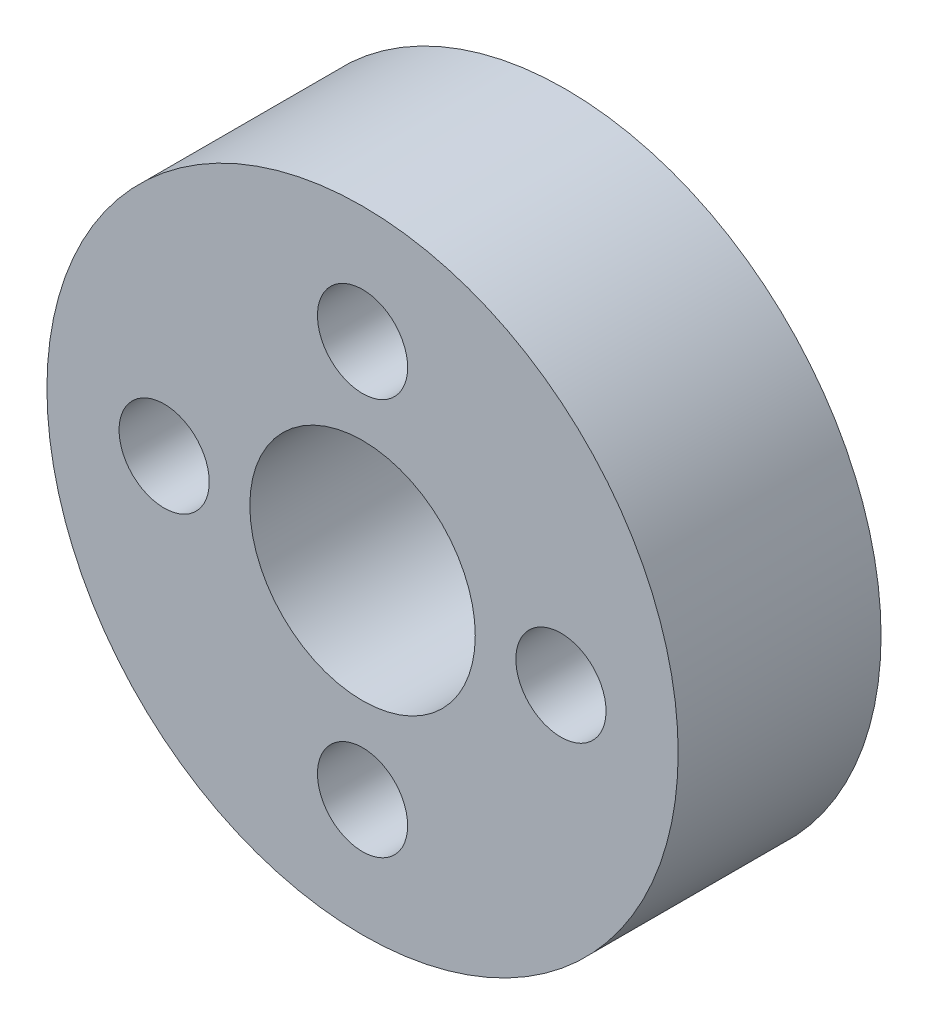
from build123d import *
from build123d.topology import SkipClean

# Parameters (mm, degrees)
SKETCH1_R           = 17.78
SKETCH1_R_2         = 2.54
SKETCH1_R_3         = 6.35
BOSS_EXTRUDE1_DEPTH = 11.43
BOSS_EXTRUDE2_START = 3.175
SKETCH2_W           = 16.51
SKETCH2_H           = 16.51
SKETCH2_R           = 6.35
BOSS_EXTRUDE2_DEPTH = 3.175


with BuildPart() as part:
    # Sketch1 → Boss-Extrude1 (new body)
    with BuildSketch(Plane.XY):
        Circle(SKETCH1_R)
        with Locations((-11.176, 0)):
            Circle(SKETCH1_R_2, mode=Mode.SUBTRACT)
        with Locations((0, -11.176)):
            Circle(SKETCH1_R_2, mode=Mode.SUBTRACT)
        with Locations((11.176, 0)):
            Circle(SKETCH1_R_2, mode=Mode.SUBTRACT)
        with Locations((0, 11.176)):
            Circle(SKETCH1_R_2, mode=Mode.SUBTRACT)
        Circle(SKETCH1_R_3, mode=Mode.SUBTRACT)
    extrude(amount=BOSS_EXTRUDE1_DEPTH)

    # Sketch2 → Boss-Extrude2 (add)
    with SkipClean():  # the faces are left unmerged after this step: merging them gives an invalid solid
        with BuildSketch(Plane(origin=(0, 0, 0), x_dir=(-1, 0, 0), z_dir=(0, 0, -1)).offset(BOSS_EXTRUDE2_START)):
            Rectangle(SKETCH2_W, SKETCH2_H)
            Circle(SKETCH2_R, mode=Mode.SUBTRACT)
        extrude(amount=-BOSS_EXTRUDE2_DEPTH)


solid = part.part
